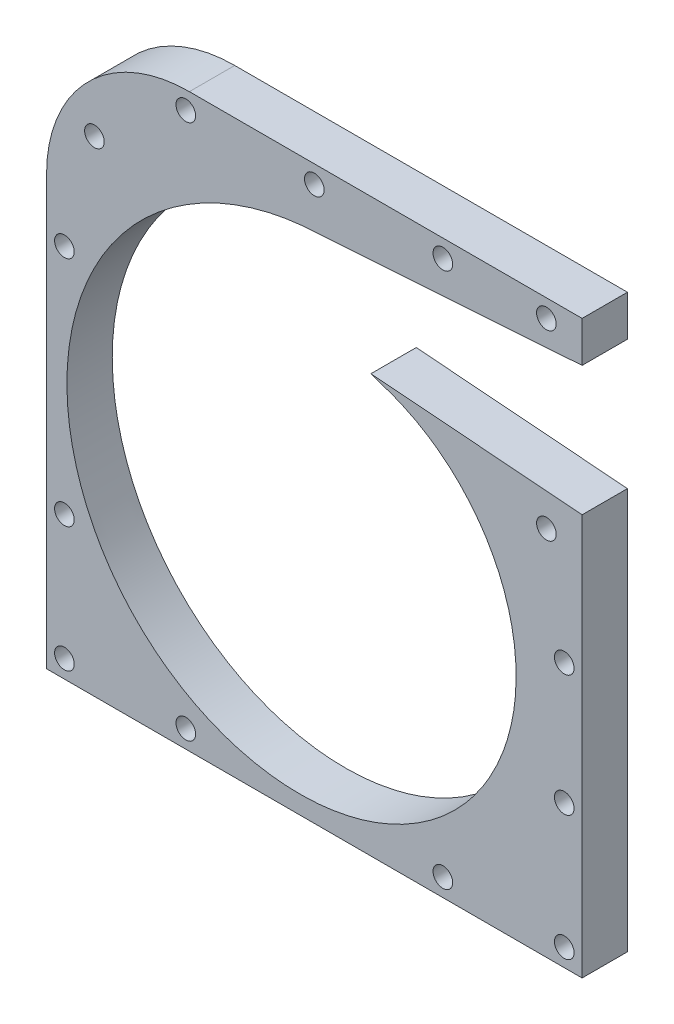
from build123d import *

# Parameters (mm, degrees)
SKETCH1_W           = 150
SKETCH1_H           = 160
BOSS_EXTRUDE1_DEPTH = 12.7
CUT_EXTRUDE2_REACH  = 203.761
SKETCH2_R           = 51.5
CUT_EXTRUDE3_REACH  = 203.761
FILLET1_R           = 40
CUT_EXTRUDE4_REACH  = 203.761
SKETCH9_R           = 2.75


with BuildPart() as part:
    # Sketch1 → Boss-Extrude1 (new body)
    with BuildSketch(Plane.XY):
        with Locations((56.818174671, 72.21769967)):
            Rectangle(SKETCH1_W, SKETCH1_H)
    extrude(amount=BOSS_EXTRUDE1_DEPTH)

    # Sketch2 → Cut-Extrude2 (cut, up to next)
    with BuildSketch(Plane.XY, mode=Mode.PRIVATE) as cut_extrude2_sk1:
        with Locations((56.818174671, 60.21769967)):
            Circle(SKETCH2_R)
    cut_extrude2_tool1 = extrude(cut_extrude2_sk1.sketch, amount=CUT_EXTRUDE2_REACH, mode=Mode.PRIVATE) & part.part
    add(cut_extrude2_tool1.solids().sort_by_distance((56.818175, 60.2177, 0))[0], mode=Mode.SUBTRACT)

    # Sketch8 → Cut-Extrude3 (cut, up to next)
    with BuildSketch(Plane.XY.offset(12.7), mode=Mode.PRIVATE) as cut_extrude3_sk1:
        with BuildLine():
            Line((58.931733711, 135.884282717), (131.818174671, 140.809388743))
            Line((131.818174671, 140.809388743), (131.818174671, 104.578808843))
            Line((131.818174671, 104.578808843), (70.908782711, 109.357489671))
            add(Edge.make_bspline(
                [(70.908782711, 109.357489671), (74.066889939, 108.718233651), (77.187896264, 107.773738498), (83.238807144, 105.290817785), (86.168565222, 103.752406014), (91.723508544, 100.120752075), (94.348550883, 98.027552137), (99.188672135, 93.347162402), (101.403617241, 90.760042381), (105.330406174, 85.172708949), (107.042130601, 82.172590891), (109.885411693, 75.857728145), (111.016868247, 72.543101399), (112.641929822, 65.712046234), (113.135458279, 62.195754428), (113.449028739, 55.084717758), (113.26902119, 51.49012346), (112.223838007, 44.35202718), (111.358642349, 40.808684362), (108.956407144, 33.904165691), (107.41937855, 30.543151797), (103.711948195, 24.131054935), (101.541588676, 21.080130687), (96.630315911, 15.407832385), (93.889475328, 12.786607763), (87.922680517, 8.080537394), (84.696827336, 5.995825962), (77.865453296, 2.452541319), (74.260058722, 0.994081919), (66.791630366, -1.227751149), (62.928743935, -1.991036235), (55.079821042, -2.777438749), (51.093947944, -2.800496703), (43.141320267, -2.087463755), (39.174739306, -1.351345355), (31.405665873, 0.871605986), (27.603351006, 2.358432727), (20.305187809, 6.046625862), (16.809514525, 8.247951859), (10.259104984, 13.301926307), (7.204534629, 16.15450094), (1.657753905, 22.42243066), (-0.834306084, 25.837680551), (-5.152459557, 33.119788397), (-6.97842411, 36.986513039), (-9.882808968, 45.041359138), (-10.961127035, 49.22932354), (-12.314157301, 57.781772746), (-12.588798304, 62.146082103), (-12.306546583, 70.896689041), (-11.749616984, 75.282798923), (-9.8060628, 83.91829096), (-8.419437722, 88.167479881), (-4.848665308, 96.371971087), (-2.66455461, 100.32708166), (2.439222898, 107.793616398), (5.358816558, 111.304857506), (11.843451019, 117.746862185), (15.408384147, 120.677458302), (23.068167194, 125.839675154), (27.162878227, 128.071150539), (35.744977915, 131.739638392), (40.232201003, 133.176533415), (49.444962438, 135.187347231), (54.170314143, 135.761181358), (58.931733711, 135.884282717)],
                knots=[0, 0, 0, 0, 0.03125, 0.03125, 0.0625, 0.0625, 0.09375, 0.09375, 0.125, 0.125, 0.15625, 0.15625, 0.1875, 0.1875, 0.21875, 0.21875, 0.25, 0.25, 0.28125, 0.28125, 0.3125, 0.3125, 0.34375, 0.34375, 0.375, 0.375, 0.40625, 0.40625, 0.4375, 0.4375, 0.46875, 0.46875, 0.5, 0.5, 0.53125, 0.53125, 0.5625, 0.5625, 0.59375, 0.59375, 0.625, 0.625, 0.65625, 0.65625, 0.6875, 0.6875, 0.71875, 0.71875, 0.75, 0.75, 0.78125, 0.78125, 0.8125, 0.8125, 0.84375, 0.84375, 0.875, 0.875, 0.90625, 0.90625, 0.9375, 0.9375, 0.96875, 0.96875, 1, 1, 1, 1], degree=3))
        make_face()
    cut_extrude3_tool1 = extrude(cut_extrude3_sk1.sketch, amount=-CUT_EXTRUDE3_REACH, mode=Mode.PRIVATE) & part.part
    add(cut_extrude3_tool1.solids().sort_by_distance((56.155485, 70.818563, 12.7))[0], mode=Mode.SUBTRACT)

    # Fillet1
    fillet1_edges = [part.edges().sort_by_distance(p)[0] for p in [
        (-18.181825329, 152.21769967, 6.35),
    ]]
    fillet(fillet1_edges, radius=FILLET1_R)

    # Sketch9 → Cut-Extrude4 (cut, up to next)
    with BuildSketch(Plane.XY.offset(12.7), mode=Mode.PRIVATE) as cut_extrude4_sk1:
        with Locations((121.818174671, 147.21769967)):
            Circle(SKETCH9_R)
    cut_extrude4_tool1 = extrude(cut_extrude4_sk1.sketch, amount=-CUT_EXTRUDE4_REACH, mode=Mode.PRIVATE) & part.part
    # Sketch9 → Cut-Extrude4 (cut, up to next)
    with BuildSketch(Plane.XY.offset(12.7), mode=Mode.PRIVATE) as cut_extrude4_sk2:
        with Locations((92.818174671, 147.21769967)):
            Circle(SKETCH9_R)
    cut_extrude4_tool2 = extrude(cut_extrude4_sk2.sketch, amount=-CUT_EXTRUDE4_REACH, mode=Mode.PRIVATE) & part.part
    # Sketch9 → Cut-Extrude4 (cut, up to next)
    with BuildSketch(Plane.XY.offset(12.7), mode=Mode.PRIVATE) as cut_extrude4_sk3:
        with Locations((56.818174671, 147.21769967)):
            Circle(SKETCH9_R)
    cut_extrude4_tool3 = extrude(cut_extrude4_sk3.sketch, amount=-CUT_EXTRUDE4_REACH, mode=Mode.PRIVATE) & part.part
    # Sketch9 → Cut-Extrude4 (cut, up to next)
    with BuildSketch(Plane.XY.offset(12.7), mode=Mode.PRIVATE) as cut_extrude4_sk4:
        with Locations((20.818174671, 147.21769967)):
            Circle(SKETCH9_R)
    cut_extrude4_tool4 = extrude(cut_extrude4_sk4.sketch, amount=-CUT_EXTRUDE4_REACH, mode=Mode.PRIVATE) & part.part
    # Sketch9 → Cut-Extrude4 (cut, up to next)
    with BuildSketch(Plane.XY.offset(12.7), mode=Mode.PRIVATE) as cut_extrude4_sk5:
        with Locations((-4.774596198, 128.093555907)):
            Circle(SKETCH9_R)
    cut_extrude4_tool5 = extrude(cut_extrude4_sk5.sketch, amount=-CUT_EXTRUDE4_REACH, mode=Mode.PRIVATE) & part.part
    # Sketch9 → Cut-Extrude4 (cut, up to next)
    with BuildSketch(Plane.XY.offset(12.7), mode=Mode.PRIVATE) as cut_extrude4_sk6:
        with Locations((-13.181825329, 97.21769967)):
            Circle(SKETCH9_R)
    cut_extrude4_tool6 = extrude(cut_extrude4_sk6.sketch, amount=-CUT_EXTRUDE4_REACH, mode=Mode.PRIVATE) & part.part
    # Sketch9 → Cut-Extrude4 (cut, up to next)
    with BuildSketch(Plane.XY.offset(12.7), mode=Mode.PRIVATE) as cut_extrude4_sk7:
        with Locations((-13.181825329, 32.21769967)):
            Circle(SKETCH9_R)
    cut_extrude4_tool7 = extrude(cut_extrude4_sk7.sketch, amount=-CUT_EXTRUDE4_REACH, mode=Mode.PRIVATE) & part.part
    # Sketch9 → Cut-Extrude4 (cut, up to next)
    with BuildSketch(Plane.XY.offset(12.7), mode=Mode.PRIVATE) as cut_extrude4_sk8:
        with Locations((-13.181825329, -2.78230033)):
            Circle(SKETCH9_R)
    cut_extrude4_tool8 = extrude(cut_extrude4_sk8.sketch, amount=-CUT_EXTRUDE4_REACH, mode=Mode.PRIVATE) & part.part
    # Sketch9 → Cut-Extrude4 (cut, up to next)
    with BuildSketch(Plane.XY.offset(12.7), mode=Mode.PRIVATE) as cut_extrude4_sk9:
        with Locations((20.818174671, -2.78230033)):
            Circle(SKETCH9_R)
    cut_extrude4_tool9 = extrude(cut_extrude4_sk9.sketch, amount=-CUT_EXTRUDE4_REACH, mode=Mode.PRIVATE) & part.part
    # Sketch9 → Cut-Extrude4 (cut, up to next)
    with BuildSketch(Plane.XY.offset(12.7), mode=Mode.PRIVATE) as cut_extrude4_sk10:
        with Locations((92.818174671, -2.78230033)):
            Circle(SKETCH9_R)
    cut_extrude4_tool10 = extrude(cut_extrude4_sk10.sketch, amount=-CUT_EXTRUDE4_REACH, mode=Mode.PRIVATE) & part.part
    # Sketch9 → Cut-Extrude4 (cut, up to next)
    with BuildSketch(Plane.XY.offset(12.7), mode=Mode.PRIVATE) as cut_extrude4_sk11:
        with Locations((126.818174671, -2.78230033)):
            Circle(SKETCH9_R)
    cut_extrude4_tool11 = extrude(cut_extrude4_sk11.sketch, amount=-CUT_EXTRUDE4_REACH, mode=Mode.PRIVATE) & part.part
    # Sketch9 → Cut-Extrude4 (cut, up to next)
    with BuildSketch(Plane.XY.offset(12.7), mode=Mode.PRIVATE) as cut_extrude4_sk12:
        with Locations((126.818174671, 32.21769967)):
            Circle(SKETCH9_R)
    cut_extrude4_tool12 = extrude(cut_extrude4_sk12.sketch, amount=-CUT_EXTRUDE4_REACH, mode=Mode.PRIVATE) & part.part
    # Sketch9 → Cut-Extrude4 (cut, up to next)
    with BuildSketch(Plane.XY.offset(12.7), mode=Mode.PRIVATE) as cut_extrude4_sk13:
        with Locations((126.818174671, 66.21769967)):
            Circle(SKETCH9_R)
    cut_extrude4_tool13 = extrude(cut_extrude4_sk13.sketch, amount=-CUT_EXTRUDE4_REACH, mode=Mode.PRIVATE) & part.part
    # Sketch9 → Cut-Extrude4 (cut, up to next)
    with BuildSketch(Plane.XY.offset(12.7), mode=Mode.PRIVATE) as cut_extrude4_sk14:
        with Locations((121.818174671, 96.21769967)):
            Circle(SKETCH9_R)
    cut_extrude4_tool14 = extrude(cut_extrude4_sk14.sketch, amount=-CUT_EXTRUDE4_REACH, mode=Mode.PRIVATE) & part.part
    add(cut_extrude4_tool1.solids().sort_by_distance((121.818175, 147.2177, 12.7))[0], mode=Mode.SUBTRACT)
    add(cut_extrude4_tool2.solids().sort_by_distance((92.818175, 147.2177, 12.7))[0], mode=Mode.SUBTRACT)
    add(cut_extrude4_tool3.solids().sort_by_distance((56.818175, 147.2177, 12.7))[0], mode=Mode.SUBTRACT)
    add(cut_extrude4_tool4.solids().sort_by_distance((20.818175, 147.2177, 12.7))[0], mode=Mode.SUBTRACT)
    add(cut_extrude4_tool5.solids().sort_by_distance((-4.774596, 128.093556, 12.7))[0], mode=Mode.SUBTRACT)
    add(cut_extrude4_tool6.solids().sort_by_distance((-13.181825, 97.2177, 12.7))[0], mode=Mode.SUBTRACT)
    add(cut_extrude4_tool7.solids().sort_by_distance((-13.181825, 32.2177, 12.7))[0], mode=Mode.SUBTRACT)
    add(cut_extrude4_tool8.solids().sort_by_distance((-13.181825, -2.7823, 12.7))[0], mode=Mode.SUBTRACT)
    add(cut_extrude4_tool9.solids().sort_by_distance((20.818175, -2.7823, 12.7))[0], mode=Mode.SUBTRACT)
    add(cut_extrude4_tool10.solids().sort_by_distance((92.818175, -2.7823, 12.7))[0], mode=Mode.SUBTRACT)
    add(cut_extrude4_tool11.solids().sort_by_distance((126.818175, -2.7823, 12.7))[0], mode=Mode.SUBTRACT)
    add(cut_extrude4_tool12.solids().sort_by_distance((126.818175, 32.2177, 12.7))[0], mode=Mode.SUBTRACT)
    add(cut_extrude4_tool13.solids().sort_by_distance((126.818175, 66.2177, 12.7))[0], mode=Mode.SUBTRACT)
    add(cut_extrude4_tool14.solids().sort_by_distance((121.818175, 96.2177, 12.7))[0], mode=Mode.SUBTRACT)


solid = part.part
